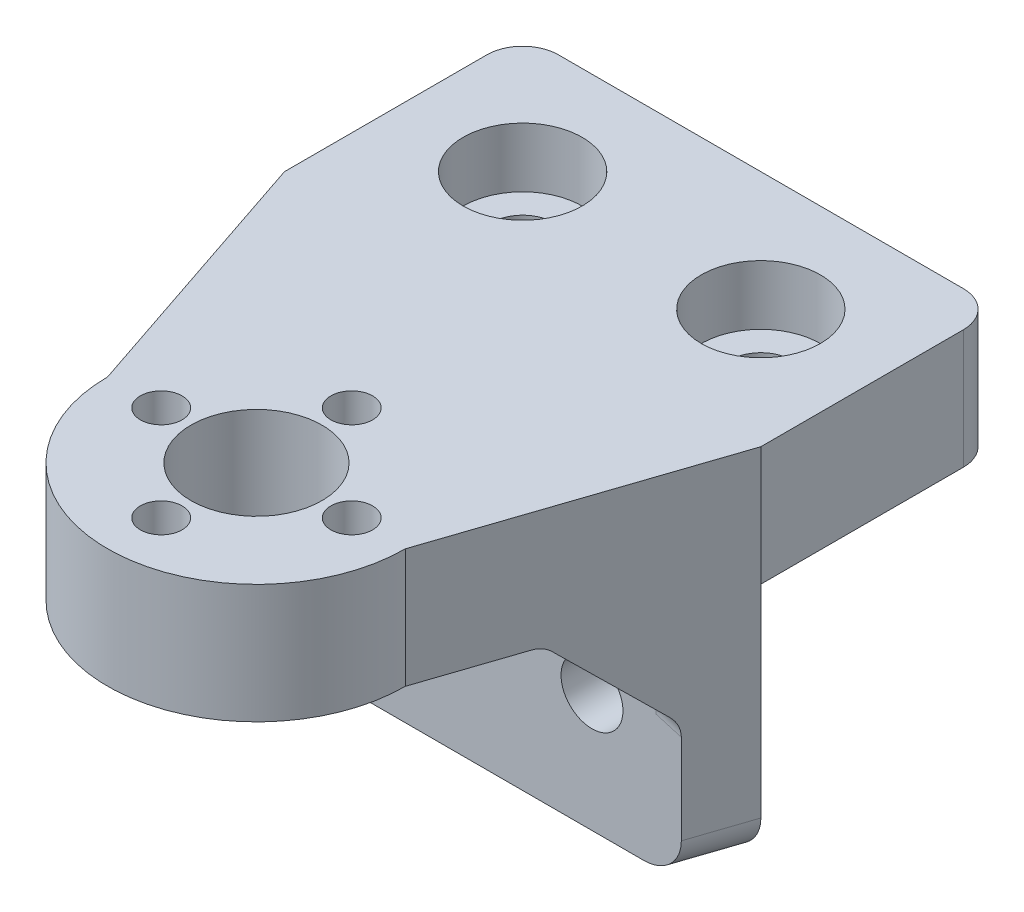
from build123d import *

# Parameters (mm, degrees)
SKETCH1_R           = 12.5
SKETCH1_R_2         = 5.5
SKETCH1_R_3         = 1.75
BOSS_EXTRUDE1_DEPTH = 10
SKETCH3_R           = 2.6
BOSS_EXTRUDE2_DEPTH = 10
BOSS_EXTRUDE3_DEPTH = 20
SKETCH5_R           = 2.6
CUT_EXTRUDE1_DEPTH  = 42.122043967
FILLET3_R           = 3
FILLET4_R           = 3
RIB1_REACH          = 61.183
SKETCH6_WALL_W      = 132.856077754
SKETCH6_WALL_H      = 2
FILLET6_R           = 2
RIB2_REACH          = 61.183
SKETCH7_WALL_W      = 132.856077754
SKETCH7_WALL_H      = 2
FILLET7_R           = 2
SKETCH8_R           = 5
CUT_EXTRUDE2_DEPTH  = 5


with BuildPart() as part:
    # Sketch1 → Boss-Extrude1 (new body)
    with BuildSketch(Plane(origin=(0, 0, 0), x_dir=(1, 0, 0), z_dir=(0, 1, 0))):
        Circle(SKETCH1_R)
        Circle(SKETCH1_R_2, mode=Mode.SUBTRACT)
        with Locations((0, 8)):
            Circle(SKETCH1_R_3, mode=Mode.SUBTRACT)
        with Locations((8, 0)):
            Circle(SKETCH1_R_3, mode=Mode.SUBTRACT)
        with Locations((0, -8)):
            Circle(SKETCH1_R_3, mode=Mode.SUBTRACT)
        with Locations((-8, 0)):
            Circle(SKETCH1_R_3, mode=Mode.SUBTRACT)
    extrude(amount=BOSS_EXTRUDE1_DEPTH)

    # Sketch3 → Boss-Extrude2 (add)
    with BuildSketch(Plane(origin=(0, 0, 0), x_dir=(1, 0, 0), z_dir=(0, 1, 0))):
        with BuildLine():
            Line((-12.5, 0), (-20, 22.35))
            Line((-20, 22.35), (-20, 42.35))
            Line((-20, 42.35), (20, 42.35))
            Line((20, 42.35), (20, 22.35))
            Line((20, 22.35), (12.5, 0))
            ThreePointArc((12.5, 0), (0, 12.5), (-12.5, 0))
        make_face()
        with Locations((-10, 32.35)):
            Circle(SKETCH3_R, mode=Mode.SUBTRACT)
        with Locations((10, 32.35)):
            Circle(SKETCH3_R, mode=Mode.SUBTRACT)
    extrude(amount=BOSS_EXTRUDE2_DEPTH)

    # Sketch4 → Boss-Extrude3 (add)
    with BuildSketch(Plane(origin=(0, 0, 0), x_dir=(1, 0, 0), z_dir=(0, 1, 0))):
        Polygon((20, 22.35), (-20, 22.35), (-18.322147651, 17.35), (18.322147651, 17.35), align=None)
    extrude(amount=-BOSS_EXTRUDE3_DEPTH)

    # Sketch5 → Cut-Extrude1 (cut, through all)
    with BuildSketch(Plane.XY.offset(-17.35)):
        with Locations((-10.822147651, -10)):
            Circle(SKETCH5_R)
        with Locations((10.822147651, -10)):
            Circle(SKETCH5_R)
    extrude(amount=-CUT_EXTRUDE1_DEPTH, mode=Mode.SUBTRACT)

    # Fillet3
    fillet3_edges = [part.edges().sort_by_distance(p)[0] for p in [
        (19.161073826, -20, -19.85),
        (-19.161073826, -20, -19.85),
    ]]
    fillet(fillet3_edges, radius=FILLET3_R)

    # Fillet4
    fillet4_edges = [part.edges().sort_by_distance(p)[0] for p in [
        (20, 5, -42.35),
        (-20, 5, -42.35),
    ]]
    fillet(fillet4_edges, radius=FILLET4_R)

    # Sketch6 wall → Rib1 (add, up to next)
    with BuildSketch(Plane(origin=(-16.866610739, -4.25, -13.0125), x_dir=(0.233087398642, 0.680588335288, 0.694600448074), z_dir=(-0.216519610858, 0.732666034336, -0.645228440356)), mode=Mode.PRIVATE) as rib1_sk1:
        with Locations((0, 1)):
            Rectangle(SKETCH6_WALL_W, SKETCH6_WALL_H)
    rib1_tool1 = extrude(rib1_sk1.sketch, amount=RIB1_REACH, mode=Mode.PRIVATE) - part.part
    add(rib1_tool1.solids().sort_by_distance((-16.866610739, -4.25, -13.0125))[0])

    # Fillet6
    fillet6_edges = [part.edges().sort_by_distance(p)[0] for p in [
        (-17.267345518, -8.188281786, -17.35),
        (-14.463028721, 0, -8.993135942),
    ]]
    fillet(fillet6_edges, radius=FILLET6_R)

    # Sketch7 wall → Rib2 (add, up to next)
    with BuildSketch(Plane(origin=(16.866610739, -4.25, -13.0125), x_dir=(-0.233087398642, 0.680588335288, 0.694600448074), z_dir=(-0.216519610858, -0.732666034336, 0.645228440356)), mode=Mode.PRIVATE) as rib2_sk1:
        with Locations((0, 1)):
            Rectangle(SKETCH7_WALL_W, SKETCH7_WALL_H)
    rib2_tool1 = extrude(rib2_sk1.sketch, amount=-RIB2_REACH, mode=Mode.PRIVATE) - part.part
    add(rib2_tool1.solids().sort_by_distance((16.866610739, -4.25, -13.0125))[0])

    # Fillet7
    fillet7_edges = [part.edges().sort_by_distance(p)[0] for p in [
        (17.267345518, -8.188281786, -17.35),
        (14.463028721, 0, -8.993135942),
    ]]
    fillet(fillet7_edges, radius=FILLET7_R)

    # Sketch8 → Cut-Extrude2 (cut)
    with BuildSketch(Plane(origin=(0, 10, 0), x_dir=(1, 0, 0), z_dir=(0, 1, 0))):
        with Locations((-10, 32.35)):
            Circle(SKETCH8_R)
        with Locations((10, 32.35)):
            Circle(SKETCH8_R)
    extrude(amount=-CUT_EXTRUDE2_DEPTH, mode=Mode.SUBTRACT)


solid = part.part
